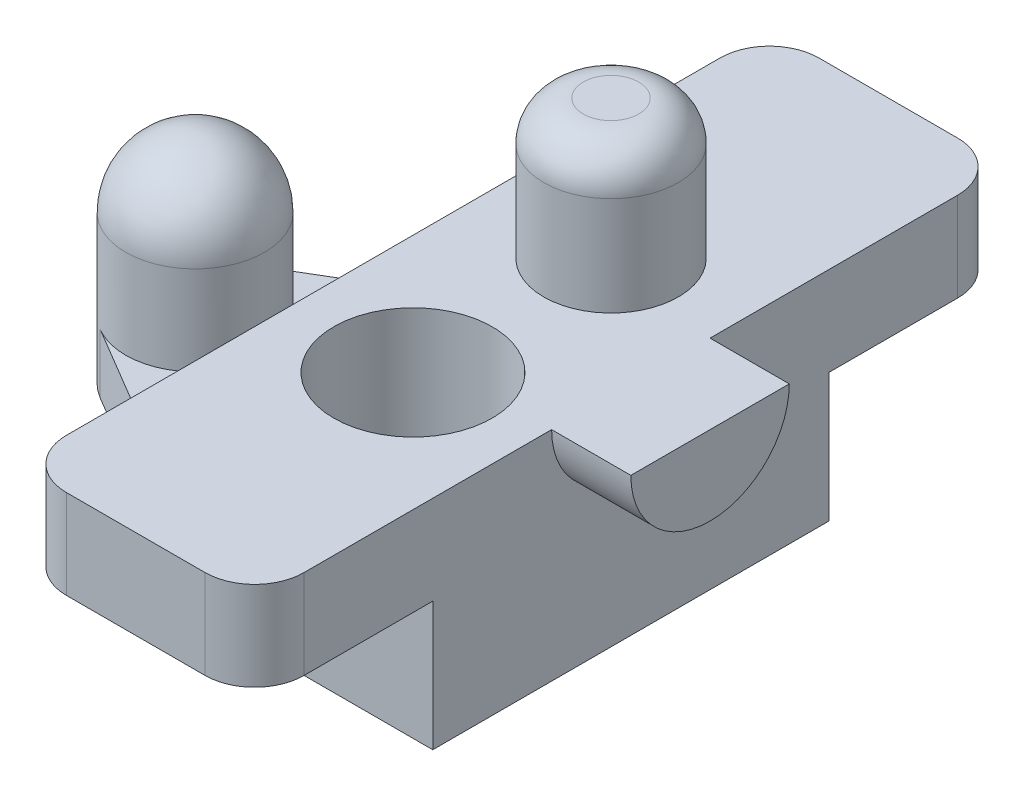
from build123d import *
from build123d.topology import SkipClean

# Parameters (mm, degrees)
BOSS_EXTRUDE1_DEPTH = 1.5
BOSS_EXTRUDE2_START = 4
SKETCH2_R           = 1.75
SKETCH2_W           = 6
SKETCH2_H           = 10
BOSS_EXTRUDE2_DEPTH = 4
BOSS_EXTRUDE3_DEPTH = 2.25
FILLET1_R           = 1.75
SKETCH4_R           = 1.7
BOSS_EXTRUDE4_DEPTH = 3.5
FILLET2_R           = 1
SKETCH5_R           = 2
CUT_EXTRUDE1_DEPTH  = 3.75
BOSS_EXTRUDE5_DEPTH = 2


with BuildPart() as part:
    # Sketch1 → Boss-Extrude1 (new body)
    with BuildSketch(Plane(origin=(0, 0, 0), x_dir=(1, 0, 0), z_dir=(0, 1, 0))):
        with BuildLine():
            Line((5, 5), (11, 5))
            Line((11, 5), (11, -5))
            Line((11, -5), (5, -5))
            Line((5, -5), (-0.892692, -1.505192))
            ThreePointArc((-0.892692, -1.505192), (-1.75, 0), (-0.892692, 1.505192))
            Line((-0.892692, 1.505192), (5, 5))
        make_face()
    extrude(amount=-BOSS_EXTRUDE1_DEPTH)

    # Sketch2 → Boss-Extrude2 (add)
    with SkipClean():  # the faces are left unmerged after this step: merging them gives an invalid solid
        with BuildSketch(Plane(origin=(0, 0, 0), x_dir=(1, 0, 0), z_dir=(0, 1, 0)).offset(BOSS_EXTRUDE2_START)):
            Circle(SKETCH2_R)
            with Locations((8, 0)):
                Rectangle(SKETCH2_W, SKETCH2_H)
        extrude(amount=-BOSS_EXTRUDE2_DEPTH)

    # Sketch3 → Boss-Extrude3 (add)
    with SkipClean():  # the faces are left unmerged after this step: merging them gives an invalid solid
        with BuildSketch(Plane(origin=(0, 4, 0), x_dir=(1, 0, 0), z_dir=(0, 1, 0))):
            with BuildLine():
                Line((5, 5), (11, 5))
                Line((11, 5), (11, 8.25))
                ThreePointArc((11, 8.25), (10.633883, 9.133883), (9.75, 9.5))
                Line((9.75, 9.5), (6.25, 9.5))
                ThreePointArc((6.25, 9.5), (5.366117, 9.133883), (5, 8.25))
                Line((5, 8.25), (5, 5))
            make_face()
            with BuildLine():
                Line((5, -5), (11, -5))
                Line((11, -5), (11, -8.25))
                ThreePointArc((11, -8.25), (10.633883, -9.133883), (9.75, -9.5))
                Line((9.75, -9.5), (6.25, -9.5))
                ThreePointArc((6.25, -9.5), (5.366117, -9.133883), (5, -8.25))
                Line((5, -8.25), (5, -5))
            make_face()
        extrude(amount=-BOSS_EXTRUDE3_DEPTH)

    # Fillet1
    fillet1_edges = [part.edges().sort_by_distance(p)[0] for p in [
        (-1.75, 4, 0),
    ]]
    fillet(fillet1_edges, radius=FILLET1_R)

    # Sketch4 → Boss-Extrude4 (add)
    with SkipClean():  # the faces are left unmerged after this step: merging them gives an invalid solid
        with BuildSketch(Plane(origin=(0, 4, 0), x_dir=(1, 0, 0), z_dir=(0, 1, 0))):
            with Locations((8, 2.5)):
                Circle(SKETCH4_R)
        extrude(amount=BOSS_EXTRUDE4_DEPTH)

    # Fillet2
    fillet2_edges = [part.edges().sort_by_distance(p)[0] for p in [
        (6.3, 7.5, -2.5),
    ]]
    fillet(fillet2_edges, radius=FILLET2_R)

    # Sketch5 → Cut-Extrude1 (cut)
    with SkipClean():  # the faces are left unmerged after this step: merging them gives an invalid solid
        with BuildSketch(Plane(origin=(0, 4, 0), x_dir=(1, 0, 0), z_dir=(0, 1, 0))):
            with Locations((8, -2.5)):
                Circle(SKETCH5_R)
        extrude(amount=-CUT_EXTRUDE1_DEPTH, mode=Mode.SUBTRACT)

    # Sketch6 → Boss-Extrude5 (add)
    with SkipClean():  # the faces are left unmerged after this step: merging them gives an invalid solid
        with BuildSketch(Plane(origin=(11, 0, 0), x_dir=(0, 0, -1), z_dir=(1, 0, 0))):
            with BuildLine():
                Line((-2, 4), (2, 4))
                ThreePointArc((2, 4), (0, 2), (-2, 4))
            make_face()
        extrude(amount=BOSS_EXTRUDE5_DEPTH)


solid = part.part
